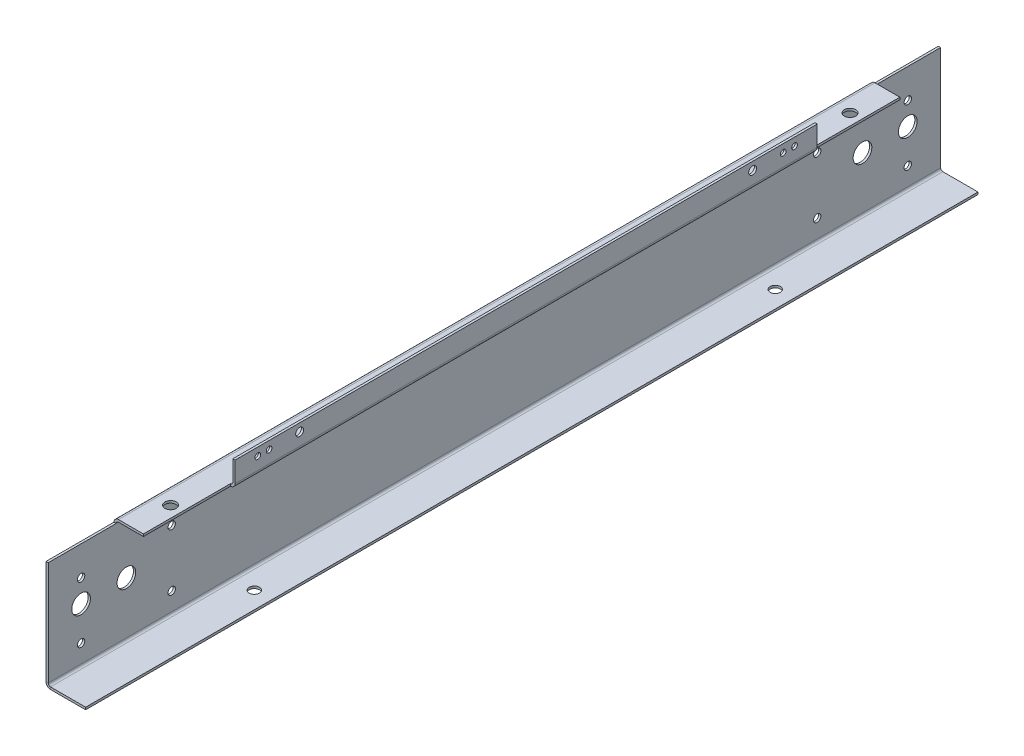
from build123d import *

# Parameters (mm, degrees)
SM_BASE_FLANGE_1_DEPTH = 394
SKETCH_6_W             = 30
SKETCH_6_H             = 60
CUT_EXTRUDE_1_DEPTH    = 24
CUT_EXTRUDE_START      = -22
SKETCH_11_W            = 4
SKETCH_11_H            = 77
CUT_EXTRUDE_6_DEPTH    = 22
SKETCH_8_R             = 8.25
SKETCH_8_R_2           = 3.25
CUT_EXTRUDE_3_DEPTH    = 10
SKETCH_12_R            = 2.5
CUT_EXTRUDE_7_DEPTH    = 10
SKETCH_13_R            = 5
CUT_EXTRUDE_8_DEPTH    = 10
SKETCH_14_R            = 4.5
CUT_EXTRUDE_9_DEPTH    = 10
SKETCH_15_R            = 3.5
CUT_EXTRUDE_10_DEPTH   = 10


# Sheet-metal steps are written as plain solids
with BuildPart() as part:
    # Sketch 1 → Базовая кромка1 (new, symmetric)
    with BuildSketch(Plane.XY):
        with BuildLine():
            Line((0, 0), (0, -18))
            ThreePointArc((0, -18), (-1.171572875, -20.828427125), (-4, -22))
            Line((-4, -22), (-26, -22))
            ThreePointArc((-26, -22), (-27.414213562, -22.585786438), (-28, -24))
            Line((-28, -24), (-28, -116))
            ThreePointArc((-28, -116), (-27.414213562, -117.414213562), (-26, -118))
            Line((-26, -118), (5, -118))
            Line((5, -118), (5, -120))
            Line((5, -120), (-26, -120))
            ThreePointArc((-26, -120), (-28.828427125, -118.828427125), (-30, -116))
            Line((-30, -116), (-30, -24))
            ThreePointArc((-30, -24), (-28.828427125, -21.171572875), (-26, -20))
            Line((-26, -20), (-4, -20))
            ThreePointArc((-4, -20), (-2.585786438, -19.414213562), (-2, -18))
            Line((-2, -18), (-2, 0))
            Line((-2, 0), (0, 0))
        make_face()
    extrude(amount=SM_BASE_FLANGE_1_DEPTH, both=True)

    # Эскиз6 → Вырез-Вытянуть1 (cut)
    with BuildSketch(Plane(origin=(0, 0, 0), x_dir=(1, 0, 0), z_dir=(0, 1, 0))):
        with Locations((-15, -364)):
            Rectangle(SKETCH_6_W, SKETCH_6_H)
        with Locations((-15, 364)):
            Rectangle(SKETCH_6_W, SKETCH_6_H)
    extrude(amount=-CUT_EXTRUDE_1_DEPTH, mode=Mode.SUBTRACT)

    # Эскиз11 → Вырез-Вытянуть6 (cut)
    with BuildSketch(Plane(origin=(0, 0, 0), x_dir=(1, 0, 0), z_dir=(0, 1, 0)).offset(CUT_EXTRUDE_START)):
        with Locations((-2, 295.5)):
            Rectangle(SKETCH_11_W, SKETCH_11_H)
        with Locations((-2, -295.5)):
            Rectangle(SKETCH_11_W, SKETCH_11_H)
    extrude(amount=CUT_EXTRUDE_6_DEPTH, mode=Mode.SUBTRACT)

    # Эскиз8 → Вырез-Вытянуть3 (cut)
    with BuildSketch(Plane.ZY.offset(30)):
        with Locations(Location((-365, -70, 0), (0, 0, 270))):
            Circle(SKETCH_8_R)
        with Locations(Location((-325, -70, 0), (0, 0, 270))):
            Circle(SKETCH_8_R)
        with Locations(Location((-365, -50, 0), (0, 0, 270))):
            Circle(SKETCH_8_R_2)
        with Locations(Location((-365, -100, 0), (0, 0, 270))):
            Circle(SKETCH_8_R_2)
        with Locations(Location((-285, -50, 0), (0, 0, 270))):
            Circle(SKETCH_8_R_2)
        with Locations(Location((-285, -100, 0), (0, 0, 270))):
            Circle(SKETCH_8_R_2)
        with Locations(Location((285, -100, 0), (0, 0, 90))):
            Circle(SKETCH_8_R_2)
        with Locations(Location((285, -50, 0), (0, 0, 90))):
            Circle(SKETCH_8_R_2)
        with Locations(Location((365, -100, 0), (0, 0, 90))):
            Circle(SKETCH_8_R_2)
        with Locations(Location((365, -50, 0), (0, 0, 90))):
            Circle(SKETCH_8_R_2)
        with Locations(Location((325, -70, 0), (0, 0, 90))):
            Circle(SKETCH_8_R)
        with Locations(Location((365, -70, 0), (0, 0, 90))):
            Circle(SKETCH_8_R)
    extrude(amount=-CUT_EXTRUDE_3_DEPTH, mode=Mode.SUBTRACT)

    # Эскиз12 → Вырез-Вытянуть7 (cut)
    with BuildSketch(Plane.ZY.offset(2)):
        with Locations(Location((-237, -7, 0), (0, 0, 270))):
            Circle(SKETCH_12_R)
        with Locations(Location((-227, -7, 0), (0, 0, 270))):
            Circle(SKETCH_12_R)
        with Locations(Location((227, -7, 0), (0, 0, 90))):
            Circle(SKETCH_12_R)
        with Locations(Location((237, -7, 0), (0, 0, 90))):
            Circle(SKETCH_12_R)
    extrude(amount=-CUT_EXTRUDE_7_DEPTH, mode=Mode.SUBTRACT)

    # Эскиз13 → Вырез-Вытянуть8 (cut)
    with BuildSketch(Plane(origin=(0, -20, 0), x_dir=(1, 0, 0), z_dir=(0, 1, 0))):
        with Locations(Location((-14, 300, 0), (0, 0, 180))):
            Circle(SKETCH_13_R)
        with Locations((-14, -300)):
            Circle(SKETCH_13_R)
    extrude(amount=-CUT_EXTRUDE_8_DEPTH, mode=Mode.SUBTRACT)

    # Эскиз14 → Вырез-Вытянуть9 (cut)
    with BuildSketch(Plane(origin=(0, -118, 0), x_dir=(1, 0, 0), z_dir=(0, 1, 0))):
        with Locations(Location((-10, 230, 0), (0, 0, 180))):
            Circle(SKETCH_14_R)
        with Locations((-10, -230)):
            Circle(SKETCH_14_R)
    extrude(amount=-CUT_EXTRUDE_9_DEPTH, mode=Mode.SUBTRACT)

    # Эскиз15 → Вырез-Вытянуть10 (cut)
    with BuildSketch(Plane(origin=(0, 0, 0), x_dir=(0, 0, -1), z_dir=(1, 0, 0))):
        with Locations(Location((-200, -7, 0), (0, 0, 90))):
            Circle(SKETCH_15_R)
        with Locations(Location((200, -7, 0), (0, 0, 270))):
            Circle(SKETCH_15_R)
    extrude(amount=-CUT_EXTRUDE_10_DEPTH, mode=Mode.SUBTRACT)


solid = part.part
